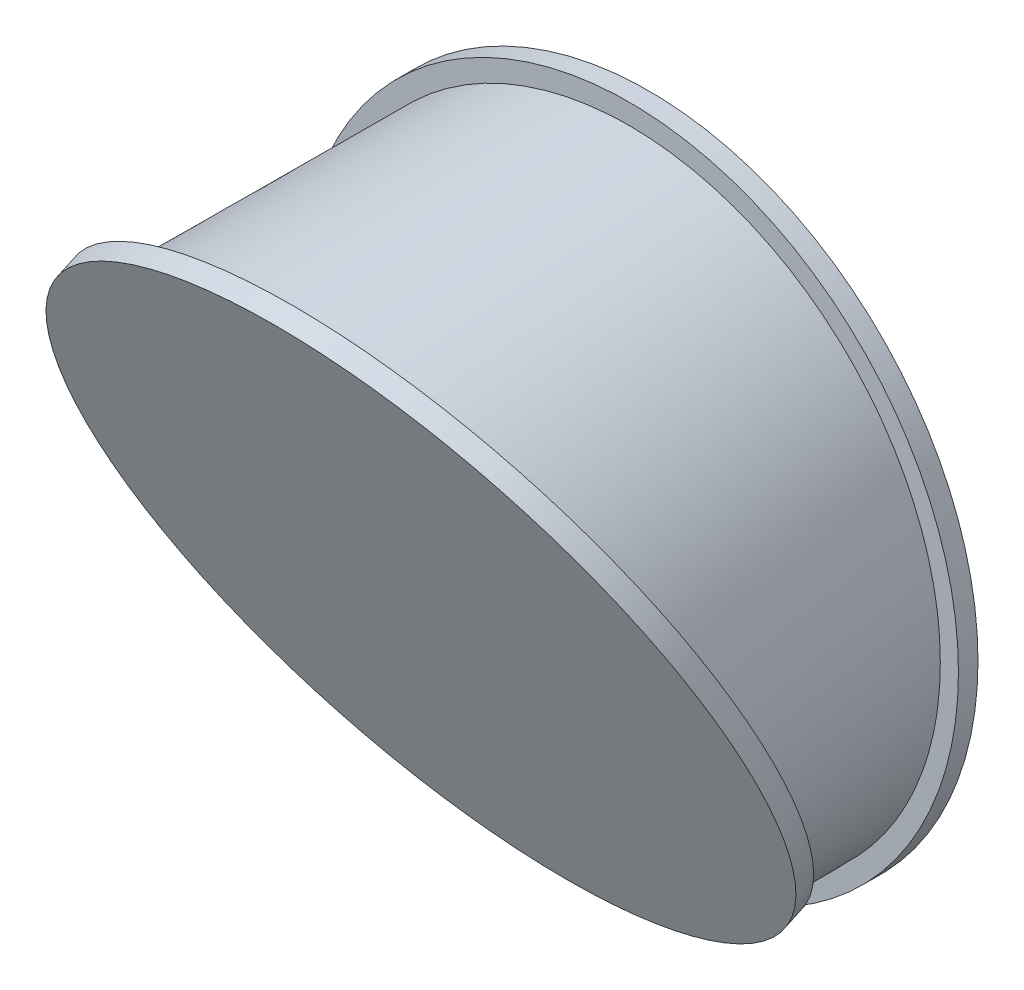
from build123d import *

# Parameters (mm, degrees)
SKETCH3_5_R         = 53
BOSS_EXTRUDE1_DEPTH = 3
SKETCH1_4_R         = 50.5
BOSS_EXTRUDE2_DEPTH = 3


with BuildPart() as part:
    # Loft1: read off the stored shape, not the designer's step
    # Loft1: loft between two sections, ruled curve by curve
    loft1_from = [
        Edge.make_bspline([(0.241544596, 47.499385851, 0), (-1.737596481, 47.509450209, 0), (-3.842288399, 47.39739319, 0), (-8.289353956, 46.8248083, 0), (-10.632369605, 46.363999982, 0), (-15.503520848, 44.970085825, 0), (-18.032309665, 44.036212824, 0), (-23.162128099, 41.567632284, 0), (-25.763433471, 40.031528494, 0), (-30.849358196, 36.257342383, 0), (-33.333264415, 34.017445551, 0), (-36.775944803, 30.112965039, 0), (-37.87581218, 28.721489593, 0), (-39.944194911, 25.767467971, 0), (-40.912622225, 24.204899544, 0), (-42.682487304, 20.926659955, 0), (-43.4838255, 19.210998711, 0), (-44.887193549, 15.653926246, 0), (-45.489126325, 13.81256268, 0), (-46.467691985, 10.039975263, 0), (-46.844246907, 8.108835207, 0), (-47.355083559, 4.19913537, 0), (-47.489321493, 2.220685673, 0), (-47.509450209, -1.737596481, 0), (-47.395340382, -3.71730908, 0), (-46.924292451, -7.632002012, 0), (-46.56739702, -9.56687182, 0), (-45.627249815, -13.349216305, 0), (-45.044075144, -15.196606398, 0), (-43.676955696, -18.767767387, 0), (-42.893107505, -20.491489645, 0), (-41.156674204, -23.787559516, 0), (-40.204188557, -25.359896199, 0), (-38.165955692, -28.334800844, 0), (-37.080296735, -29.737390161, 0), (-33.677503614, -33.676681379, 0), (-31.216505982, -35.941724111, 0), (-26.169228392, -39.767439736, 0), (-23.583679985, -41.329919793, 0), (-18.47923273, -43.850543776, 0), (-15.96007234, -44.810086685, 0), (-11.103349361, -46.253469175, 0), (-8.765141384, -46.738082523, 0), (-4.324129102, -47.3558652, 0), (-2.220685673, -47.489321493, 0), (1.737596481, -47.509450209, 0), (3.842288399, -47.39739319, 0), (8.289353956, -46.8248083, 0), (10.632369605, -46.363999982, 0), (15.503520848, -44.970085825, 0), (18.032309665, -44.036212824, 0), (23.162128099, -41.567632284, 0), (25.763433471, -40.031528494, 0), (30.849358196, -36.257342383, 0), (33.333264415, -34.017445551, 0), (36.775944803, -30.112965039, 0), (37.87581218, -28.721489593, 0), (39.944194911, -25.767467971, 0), (40.912622225, -24.204899544, 0), (42.682487304, -20.926659955, 0), (43.4838255, -19.210998711, 0), (44.887193549, -15.653926246, 0), (45.489126325, -13.81256268, 0), (46.467691985, -10.039975263, 0), (46.844246907, -8.108835207, 0), (47.355083559, -4.19913537, 0), (47.489321493, -2.220685673, 0), (47.509450209, 1.737596481, 0), (47.395340382, 3.71730908, 0), (46.924292451, 7.632002012, 0), (46.56739702, 9.56687182, 0), (45.627249815, 13.349216305, 0), (45.044075144, 15.196606398, 0), (43.676955696, 18.767767387, 0), (42.893107505, 20.491489645, 0), (41.156674204, 23.787559516, 0), (40.204188557, 25.359896199, 0), (38.165955692, 28.334800844, 0), (37.080296735, 29.737390161, 0), (33.677503614, 33.676681379, 0), (31.216505982, 35.941724111, 0), (26.169228392, 39.767439736, 0), (23.583679985, 41.329919793, 0), (18.47923273, 43.850543776, 0), (15.96007234, 44.810086685, 0), (11.103349361, 46.253469175, 0), (8.765141384, 46.738082523, 0), (4.324129102, 47.3558652, 0), (2.220685673, 47.489321493, 0), (0.241544596, 47.499385851, 0)], [0, 0, 0, 0, 0.03125, 0.03125, 0.0625, 0.0625, 0.09375, 0.09375, 0.125, 0.125, 0.15625, 0.15625, 0.171875, 0.171875, 0.1875, 0.1875, 0.203125, 0.203125, 0.21875, 0.21875, 0.234375, 0.234375, 0.25, 0.25, 0.265625, 0.265625, 0.28125, 0.28125, 0.296875, 0.296875, 0.3125, 0.3125, 0.328125, 0.328125, 0.34375, 0.34375, 0.375, 0.375, 0.40625, 0.40625, 0.4375, 0.4375, 0.46875, 0.46875, 0.5, 0.5, 0.53125, 0.53125, 0.5625, 0.5625, 0.59375, 0.59375, 0.625, 0.625, 0.65625, 0.65625, 0.671875, 0.671875, 0.6875, 0.6875, 0.703125, 0.703125, 0.71875, 0.71875, 0.734375, 0.734375, 0.75, 0.75, 0.765625, 0.765625, 0.78125, 0.78125, 0.796875, 0.796875, 0.8125, 0.8125, 0.828125, 0.828125, 0.84375, 0.84375, 0.875, 0.875, 0.90625, 0.90625, 0.9375, 0.9375, 0.96875, 0.96875, 1, 1, 1, 1], 3),
    ]
    loft1_to = [
        Edge.make_bspline([(-0.000258413, 45.315389351, 56.103987448), (-2.083591746, 45.315379593, 56.103982898), (-4.298427792, 45.198256849, 56.049367665), (-8.976420743, 44.630417387, 55.784579776), (-11.440251935, 44.179430006, 55.574280906), (-16.560244217, 42.825986395, 54.943159786), (-19.217088791, 41.922795124, 54.521994779), (-24.60360049, 39.542868117, 53.41221659), (-27.3335504, 38.064799025, 52.722981653), (-32.66686306, 34.439542895, 51.032496957), (-35.26946543, 32.290628285, 50.030441618), (-38.872371472, 28.54905177, 48.285715835), (-40.022655762, 27.216248807, 47.664219607), (-42.184044209, 24.388079988, 46.345422828), (-43.195055576, 22.892693332, 45.648112578), (-45.040481753, 19.756671584, 44.185761621), (-45.874791809, 18.116046437, 43.420725551), (-47.332942587, 14.715799072, 41.835164165), (-47.956681379, 12.956222787, 41.014660268), (-48.966522761, 9.35243798, 39.334187814), (-49.352543738, 7.508309779, 38.474256711), (-49.869310496, 3.775991683, 36.7338482), (-50.000010767, 1.887907021, 35.853419864), (-49.999989232, -1.888375425, 34.09251044), (-49.869267427, -3.776458861, 33.212082674), (-49.352458103, -7.508772116, 31.47167642), (-48.966416093, -9.352896701, 30.611747004), (-47.95653361, -12.956672047, 28.931278962), (-47.332774749, -14.716242489, 28.11077779), (-45.874585192, -18.116476194, 26.525222773), (-45.040256424, -19.757093525, 25.760190348), (-43.194794481, -22.893097985, 24.297847452), (-42.183766059, -24.388475169, 23.60054162), (-40.022345356, -27.21662374, 22.281754282), (-38.872045866, -28.549415928, 21.660263079), (-35.269097151, -32.29095869, 19.915553035), (-32.666470272, -34.439848919, 18.913509065), (-27.333116266, -38.065055085, 17.223047667), (-24.603149499, -39.543098603, 16.533824656), (-19.216610657, -41.922975149, 15.424069997), (-16.559755782, -42.82614153, 15.002916597), (-11.439748065, -44.179537177, 14.371817842), (-8.975911729, -44.630501476, 14.161529736), (-4.297912302, -45.198297114, 13.896762282), (-2.08307492, -45.31539911, 13.842156724), (2.083591746, -45.315379593, 13.842165825), (4.298427792, -45.198256849, 13.896781058), (8.976420743, -44.630417387, 14.161568947), (11.440251935, -44.179430006, 14.371867817), (16.560244217, -42.825986395, 15.002988937), (19.217088791, -41.922795124, 15.424153944), (24.60360049, -39.542868117, 16.533932133), (27.3335504, -38.064799025, 17.22316707), (32.66686306, -34.439542895, 18.913651766), (35.26946543, -32.290628285, 19.915707106), (38.872371472, -28.54905177, 21.660432888), (40.022655762, -27.216248807, 22.281929117), (42.184044209, -24.388079988, 23.600725896), (43.195055576, -22.892693332, 24.298036145), (45.040481753, -19.756671584, 25.760387102), (45.874791809, -18.116046437, 26.525423172), (47.332942587, -14.715799072, 28.110984559), (47.956681379, -12.956222787, 28.931488455), (48.966522761, -9.35243798, 30.611960909), (49.352543738, -7.508309779, 31.471892012), (49.869310496, -3.775991683, 33.212300523), (50.000010767, -1.887907021, 34.09272886), (49.999989232, 1.888375425, 35.853638284), (49.869267427, 3.776458861, 36.734066049), (49.352458103, 7.508772116, 38.474472303), (48.966416093, 9.352896701, 39.334401719), (47.95653361, 12.956672047, 41.014869761), (47.332774749, 14.716242489, 41.835370933), (45.874585192, 18.116476194, 43.42092595), (45.040256424, 19.757093525, 44.185958375), (43.194794481, 22.893097985, 45.648301271), (42.183766059, 24.388475169, 46.345607104), (40.022345356, 27.21662374, 47.664394441), (38.872045866, 28.549415928, 48.285885645), (35.269097151, 32.29095869, 50.030595688), (32.666470272, 34.439848919, 51.032639658), (27.333116266, 38.065055085, 52.723101056), (24.603149499, 39.543098603, 53.412324067), (19.216610657, 41.922975149, 54.522078726), (16.559755782, 42.82614153, 54.943232126), (11.439748065, 44.179537177, 55.574330881), (8.975911729, 44.630501476, 55.784618987), (4.297912302, 45.198297114, 56.049386442), (2.08307492, 45.31539911, 56.103991999), (-0.000258413, 45.315389351, 56.103987448)], [0, 0, 0, 0, 0.03125, 0.03125, 0.0625, 0.0625, 0.09375, 0.09375, 0.125, 0.125, 0.15625, 0.15625, 0.171875, 0.171875, 0.1875, 0.1875, 0.203125, 0.203125, 0.21875, 0.21875, 0.234375, 0.234375, 0.25, 0.25, 0.265625, 0.265625, 0.28125, 0.28125, 0.296875, 0.296875, 0.3125, 0.3125, 0.328125, 0.328125, 0.34375, 0.34375, 0.375, 0.375, 0.40625, 0.40625, 0.4375, 0.4375, 0.46875, 0.46875, 0.5, 0.5, 0.53125, 0.53125, 0.5625, 0.5625, 0.59375, 0.59375, 0.625, 0.625, 0.65625, 0.65625, 0.671875, 0.671875, 0.6875, 0.6875, 0.703125, 0.703125, 0.71875, 0.71875, 0.734375, 0.734375, 0.75, 0.75, 0.765625, 0.765625, 0.78125, 0.78125, 0.796875, 0.796875, 0.8125, 0.8125, 0.828125, 0.828125, 0.84375, 0.84375, 0.875, 0.875, 0.90625, 0.90625, 0.9375, 0.9375, 0.96875, 0.96875, 1, 1, 1, 1], 3),
    ]
    loft1 = Solid(Shell([*[Face.make_surface_from_curves(loft1_from[k], loft1_to[k]) for k in range(1)], Face(Wire(loft1_from)), Face(Wire(loft1_to))]))
    add(loft1)

    # Sketch3<5> → Boss-Extrude1 (add)
    with BuildSketch(Plane(origin=(0, -13.395464637, 28.726666617), x_dir=(1, 0, 0), z_dir=(0, -0.4226182617407003, 0.9063077870366496))):
        with Locations(Location((0, 14.780259894, 0), (0, 0, 270))):
            Circle(SKETCH3_5_R)
    extrude(amount=-BOSS_EXTRUDE1_DEPTH)

    # Sketch1<4> → Boss-Extrude2 (add)
    with BuildSketch(Plane.XY):
        Circle(SKETCH1_4_R)
    extrude(amount=BOSS_EXTRUDE2_DEPTH)


solid = part.part
